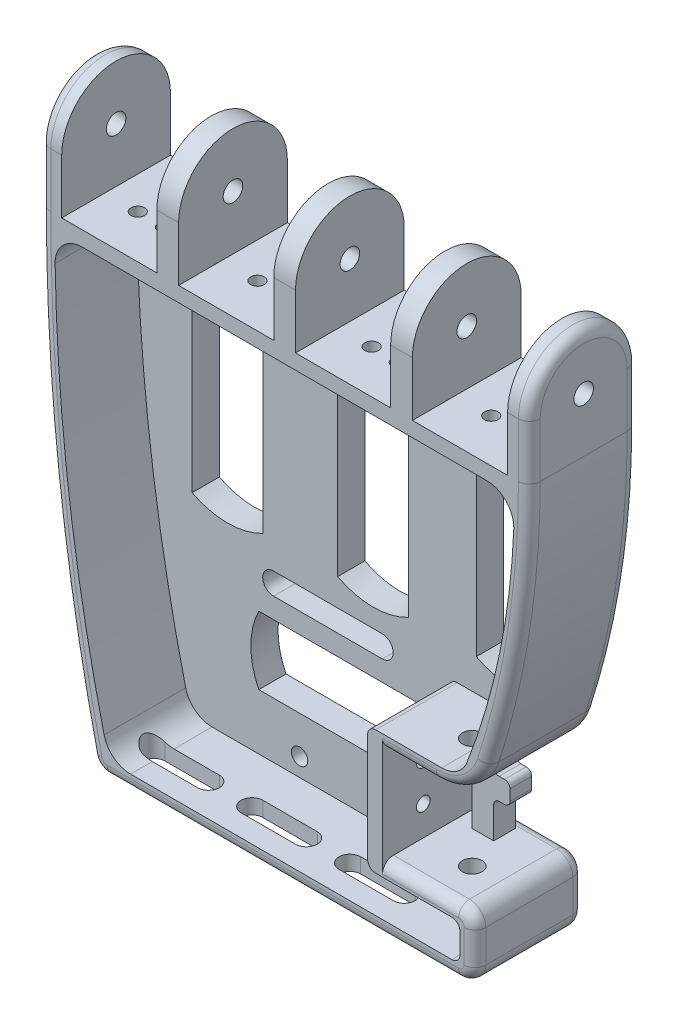
from build123d import *

# Parameters (mm, degrees)
BOSS_EXTRUDE1_DEPTH = 20
CUT_EXTRUDE1_DEPTH  = 15
SKETCH3_W           = 4
SKETCH3_H           = 20
BOSS_EXTRUDE2_DEPTH = 20
CUT_EXTRUDE2_DEPTH  = 140.731886125
SKETCH4_4_R         = 1.8
CUT_EXTRUDE3_DEPTH  = 140.731886125
SKETCH7_R           = 1.8
CUT_EXTRUDE5_DEPTH  = 25
SKETCH9_R           = 1.25
CUT_EXTRUDE6_DEPTH  = 10
SKETCH10_W          = 13
SKETCH10_H          = 35
CUT_EXTRUDE9_DEPTH  = 21.5
SKETCH11_R          = 1.25
CUT_EXTRUDE10_DEPTH = 33
SKETCH12_W          = 30
SKETCH12_H          = 12.5
CUT_EXTRUDE11_DEPTH = 31.5
SKETCH15_R          = 1.5
CUT_EXTRUDE13_DEPTH = 50
CUT_EXTRUDE14_DEPTH = 7
CUT_EXTRUDE15_DEPTH = 28.5
FILLET1_R           = 10
FILLET2_R           = 3
FILLET3_R           = 3
FILLET4_R           = 3
FILLET6_R           = 2
FILLET7_R           = 2
SKETCH18_W          = 4
SKETCH18_H          = 4
BOSS_EXTRUDE3_DEPTH = 17.6
SKETCH19_W          = 4
SKETCH19_H          = 4
BOSS_EXTRUDE4_DEPTH = 3
FILLET12_R          = 1


with BuildPart() as part:
    # Sketch1 → Boss-Extrude1 (new body)
    with BuildSketch(Plane.XY):
        with BuildLine():
            Line((0, 0), (-70, 0))
            ThreePointArc((-70, 0), (-77.491408833, 42.206893078), (-80, 85))
            Line((-80, 85), (10, 85))
            ThreePointArc((10, 85), (7.480734581, 56.852621875), (0.003021395, 29.6))
            Line((0.003021395, 29.6), (-16.996978605, 29.6))
            Line((-16.996978605, 29.6), (-16.996978605, 12))
            Line((-16.996978605, 12), (0, 12))
            Line((0, 12), (0, 0))
        make_face()
    extrude(amount=BOSS_EXTRUDE1_DEPTH)

    # Sketch2 → Cut-Extrude1 (cut)
    with BuildSketch(Plane.XY.offset(20)):
        with BuildLine():
            Line((2.149619209, 82.25), (-72.210442127, 82.25))
            ThreePointArc((-72.210442127, 82.25), (-75.773836153, 80.757452496), (-77.209816236, 77.170889205))
            ThreePointArc((-77.209816236, 77.170889205), (-74.668467732, 41.620651671), (-68.20184384, 6.571249159))
            ThreePointArc((-68.20184384, 6.571249159), (-66.433588024, 3.819748468), (-63.342775364, 2.75))
            Line((-63.342775364, 2.75), (-4.25, 2.75))
            ThreePointArc((-4.25, 2.75), (-3.189339828, 3.189339828), (-2.75, 4.25))
            Line((-2.75, 4.25), (-2.75, 8))
            ThreePointArc((-2.75, 8), (-3.189339828, 9.060660172), (-4.25, 9.5))
            Line((-4.25, 9.5), (-18.243685565, 9.5))
            Line((-18.243685565, 9.5), (-19.743685565, 9.5))
            Line((-19.743685565, 9.5), (-19.743685565, 11))
            Line((-19.743685565, 11), (-19.743685565, 30.85))
            Line((-19.743685565, 30.85), (-19.743685565, 32.35))
            Line((-19.743685565, 32.35), (-18.243685565, 32.35))
            Line((-18.243685565, 32.35), (-6.122859331, 32.35))
            ThreePointArc((-6.122859331, 32.35), (-3.295366032, 33.226253931), (-1.45891358, 35.547887342))
            ThreePointArc((-1.45891358, 35.547887342), (4.551718513, 55.944404372), (7.145590312, 77.049319303))
            ThreePointArc((7.145590312, 77.049319303), (5.755406466, 80.713855981), (2.149619209, 82.25))
        make_face()
        with BuildLine():
            ThreePointArc((-19.743685565, 30.85), (-19.304345736, 31.910660172), (-18.243685565, 32.35))
            Line((-18.243685565, 32.35), (-19.743685565, 32.35))
            Line((-19.743685565, 32.35), (-19.743685565, 30.85))
        make_face()
        with BuildLine():
            ThreePointArc((-18.243685565, 9.5), (-19.304345736, 9.939339828), (-19.743685565, 11))
            Line((-19.743685565, 11), (-19.743685565, 9.5))
            Line((-19.743685565, 9.5), (-18.243685565, 9.5))
        make_face()
    extrude(amount=-CUT_EXTRUDE1_DEPTH, mode=Mode.SUBTRACT)

    # Sketch3 → Boss-Extrude2 (add)
    with BuildSketch(Plane(origin=(0, 85, 0), x_dir=(1, 0, 0), z_dir=(0, 1, 0))):
        with Locations((-78, -10)):
            Rectangle(SKETCH3_W, SKETCH3_H)
        with Locations((-56.5, -10)):
            Rectangle(SKETCH3_W, SKETCH3_H)
        with Locations((-35, -10)):
            Rectangle(SKETCH3_W, SKETCH3_H)
        with Locations((-13.5, -10)):
            Rectangle(SKETCH3_W, SKETCH3_H)
        with Locations((8, -10)):
            Rectangle(SKETCH3_W, SKETCH3_H)
    extrude(amount=BOSS_EXTRUDE2_DEPTH)

    # Sketch4 → Cut-Extrude2 (cut, through all)
    with BuildSketch(Plane.ZY.offset(80)):
        with BuildLine():
            Line((0, 105), (0, 95))
            ThreePointArc((0, 95), (2.928932188, 102.071067812), (10, 105))
            Line((10, 105), (0, 105))
        make_face()
        with BuildLine():
            Line((20, 105), (10, 105))
            ThreePointArc((10, 105), (17.071067812, 102.071067812), (20, 95))
            Line((20, 95), (20, 105))
        make_face()
    extrude(amount=-CUT_EXTRUDE2_DEPTH, mode=Mode.SUBTRACT)

    # Sketch4<4> → Cut-Extrude3 (cut, through all)
    with BuildSketch(Plane.ZY.offset(80)):
        with Locations((10, 95)):
            Circle(SKETCH4_4_R)
    extrude(amount=-CUT_EXTRUDE3_DEPTH, mode=Mode.SUBTRACT)

    # Sketch7 → Cut-Extrude5 (cut)
    with BuildSketch(Plane(origin=(0, 32.35, 0), x_dir=(1, 0, 0), z_dir=(0, 1, 0))):
        with Locations(Location((-7.996978605, -12.5, 0), (0, 0, 270))):
            Circle(SKETCH7_R)
    extrude(amount=-CUT_EXTRUDE5_DEPTH, mode=Mode.SUBTRACT)

    # Sketch9 → Cut-Extrude6 (cut)
    with BuildSketch(Plane(origin=(0, 85, 0), x_dir=(1, 0, 0), z_dir=(0, 1, 0))):
        with Locations(Location((-70, -12, 0), (0, 0, 270))):
            Circle(SKETCH9_R)
        with Locations(Location((-65, -12, 0), (0, 0, 270))):
            Circle(SKETCH9_R)
        with Locations(Location((-48, -12, 0), (0, 0, 90))):
            Circle(SKETCH9_R)
        with Locations(Location((-43, -12, 0), (0, 0, 90))):
            Circle(SKETCH9_R)
        with Locations(Location((-27, -12, 0), (0, 0, 270))):
            Circle(SKETCH9_R)
        with Locations(Location((-22, -12, 0), (0, 0, 270))):
            Circle(SKETCH9_R)
        with Locations(Location((-5, -12, 0), (0, 0, 90))):
            Circle(SKETCH9_R)
        with Locations(Location((0, -12, 0), (0, 0, 90))):
            Circle(SKETCH9_R)
    extrude(amount=-CUT_EXTRUDE6_DEPTH, mode=Mode.SUBTRACT)

    # Sketch10 → Cut-Extrude9 (cut, symmetric)
    with BuildSketch(Plane.XY.offset(6)):
        with Locations((-60.5, 55.75)):
            Rectangle(SKETCH10_W, SKETCH10_H)
        with Locations((-33.75, 55.75)):
            Rectangle(SKETCH10_W, SKETCH10_H)
        with Locations((-8.25, 55.75)):
            Rectangle(SKETCH10_W, SKETCH10_H)
        with BuildLine():
            Line((-14.75, 38.25), (-1.75, 38.25))
            ThreePointArc((-1.75, 38.25), (-8.25, 36.649596768), (-14.75, 38.25))
        make_face()
        with BuildLine():
            Line((-40.25, 38.25), (-27.25, 38.25))
            ThreePointArc((-27.25, 38.25), (-33.75, 36.649596768), (-40.25, 38.25))
        make_face()
        with BuildLine():
            Line((-67, 38.25), (-54, 38.25))
            ThreePointArc((-54, 38.25), (-60.5, 36.649596768), (-67, 38.25))
        make_face()
        with BuildLine():
            ThreePointArc((-67, 73.25), (-60.5, 74.850403232), (-54, 73.25))
            Line((-54, 73.25), (-67, 73.25))
        make_face()
        with BuildLine():
            ThreePointArc((-40.25, 73.25), (-33.75, 74.850403232), (-27.25, 73.25))
            Line((-27.25, 73.25), (-40.25, 73.25))
        make_face()
        with BuildLine():
            ThreePointArc((-14.75, 73.25), (-8.25, 74.850403232), (-1.75, 73.25))
            Line((-1.75, 73.25), (-14.75, 73.25))
        make_face()
    extrude(amount=CUT_EXTRUDE9_DEPTH, both=True, mode=Mode.SUBTRACT)

    # Sketch11 → Cut-Extrude10 (cut)
    with BuildSketch(Plane.ZY.offset(19.743685565)):
        with Locations((12.5, 24.455)):
            Circle(SKETCH11_R)
        with Locations((12.5, 17.455)):
            Circle(SKETCH11_R)
    extrude(amount=-CUT_EXTRUDE10_DEPTH, mode=Mode.SUBTRACT)

    # Sketch12 → Cut-Extrude11 (cut, symmetric)
    with BuildSketch(Plane.XY.offset(6)):
        with Locations((-39.743685565, 19.25)):
            Rectangle(SKETCH12_W, SKETCH12_H)
        with BuildLine():
            ThreePointArc((-24.743685565, 25.5), (-23.271155381, 19.25), (-24.743685565, 13))
            Line((-24.743685565, 13), (-24.743685565, 25.5))
        make_face()
        with BuildLine():
            Line((-54.743685565, 25.5), (-54.743685565, 13))
            ThreePointArc((-54.743685565, 13), (-56.216215748, 19.25), (-54.743685565, 25.5))
        make_face()
    extrude(amount=CUT_EXTRUDE11_DEPTH, both=True, mode=Mode.SUBTRACT)

    # Sketch15 → Cut-Extrude13 (cut, symmetric)
    with BuildSketch(Plane.XY.offset(6)):
        with Locations(Location((-47.25, 6.125, 0), (0, 0, 180))):
            Circle(SKETCH15_R)
        with Locations(Location((-19.743685565, 6.125, 0), (0, 0, 180))):
            Circle(SKETCH15_R)
        with Locations(Location((1.75, 76.125, 0), (0, 0, 180))):
            Circle(SKETCH15_R)
        with Locations(Location((-47.25, 76.125, 0), (0, 0, 180))):
            Circle(SKETCH15_R)
    extrude(amount=CUT_EXTRUDE13_DEPTH, both=True, mode=Mode.SUBTRACT)

    # Sketch16 → Cut-Extrude14 (cut)
    with BuildSketch(Plane.XZ):
        with BuildLine():
            Line((-37, 12), (-47, 12))
            ThreePointArc((-47, 12), (-49, 14), (-47, 16))
            Line((-47, 16), (-37, 16))
            ThreePointArc((-37, 16), (-35, 14), (-37, 12))
        make_face()
        with BuildLine():
            Line((-29, 16), (-19, 16))
            ThreePointArc((-19, 16), (-17, 14), (-19, 12))
            Line((-19, 12), (-29, 12))
            ThreePointArc((-29, 12), (-31, 14), (-29, 16))
        make_face()
        with BuildLine():
            Line((-55, 12), (-65, 12))
            ThreePointArc((-65, 12), (-67, 14), (-65, 16))
            Line((-65, 16), (-55, 16))
            ThreePointArc((-55, 16), (-53, 14), (-55, 12))
        make_face()
    extrude(amount=-CUT_EXTRUDE14_DEPTH, mode=Mode.SUBTRACT)

    # Sketch17 → Cut-Extrude15 (cut, symmetric)
    with BuildSketch(Plane.XY.offset(6)):
        with BuildLine():
            Line((-52.030411459, 33.25), (-32.030411459, 33.25))
            ThreePointArc((-32.030411459, 33.25), (-30.030411459, 31.25), (-32.030411459, 29.25))
            Line((-32.030411459, 29.25), (-52.030411459, 29.25))
            ThreePointArc((-52.030411459, 29.25), (-54.030411459, 31.25), (-52.030411459, 33.25))
        make_face()
    extrude(amount=CUT_EXTRUDE15_DEPTH, both=True, mode=Mode.SUBTRACT)

    # Fillet1
    # the kernel refuses this fillet: 10 mm, written as the material it takes off along each edge
    with BuildSketch(Plane(origin=(0.003021395, 29.6, -18.37153932), x_dir=(-1, 0, 0), z_dir=(0, 0, 1))) as fillet1_piece_1:
        with BuildLine():
            CenterArc((7.113026, -10), FILLET1_R, 90, 72.198634336)
            ThreePointArc((-2.408195061, -6.942820008), (-1.244338894, -3.457451835), (0, 0))
            Line((0, 0), (7.113026, 0))
        make_face()
    extrude(amount=56.743078639, mode=Mode.SUBTRACT)

    # Fillet2
    fillet2_edges = [part.edges().sort_by_distance(p)[0] for p in [
        (0, 12, 10),
    ]]
    fillet(fillet2_edges, radius=FILLET2_R)

    # Fillet3
    fillet3_edges = [part.edges().sort_by_distance(p)[0] for p in [
        (0, 0, 10),
    ]]
    fillet(fillet3_edges, radius=FILLET3_R)

    # Fillet4
    fillet4_edges = [part.edges().sort_by_distance(p)[0] for p in [
        (-70, 0, 10),
    ]]
    fillet(fillet4_edges, radius=FILLET4_R)

    # Fillet6
    fillet6_edges = [part.edges().sort_by_distance(p)[0] for p in [
        (10, 90, 20),
        (-12.053491605, 29.6, 20),
        (10, 105, 10),
        (10, 90, 0),
        (8.091311924, 60.476093661, 0),
        (8.091311924, 60.476093661, 20),
        (-1.218137325, 31.520030943, 0),
        (-1.218137325, 31.520030943, 20),
        (-12.053491605, 29.6, 0),
    ]]
    fillet(fillet6_edges, radius=FILLET6_R)

    # Fillet7
    fillet7_edges = [part.edges().sort_by_distance(p)[0] for p in [
        (-80, 90, 20),
        (-80, 105, 10),
        (-80, 90, 0),
        (-77.62887866, 43.392018011, 20),
        (-9.998489302, 12, 0),
        (-9.998489302, 12, 20),
        (-0.878679656, 11.121320344, 0),
        (-0.878679656, 11.121320344, 20),
        (0, 6, 0),
        (0, 6, 20),
        (-0.878679656, 0.878679656, 0),
        (-0.878679656, 0.878679656, 20),
        (-35.31182665, 0, 0),
        (-35.31182665, 0, 20),
        (-69.490246636, 0.651419723, 0),
        (-69.490246636, 0.651419723, 20),
        (-77.62887866, 43.392018011, 0),
    ]]
    fillet(fillet7_edges, radius=FILLET7_R)

    # Sketch18 → Boss-Extrude3 (add)
    with BuildSketch(Plane.XZ.offset(-29.6)):
        with Locations((-12.053491605, 4.5)):
            Rectangle(SKETCH18_W, SKETCH18_H)
    extrude(amount=BOSS_EXTRUDE3_DEPTH)

    # Sketch19 → Boss-Extrude4 (add)
    with BuildSketch(Plane(origin=(-10.053491605, 0, 0), x_dir=(0, 0, -1), z_dir=(1, 0, 0))):
        with Locations((-4.5, 20.8)):
            Rectangle(SKETCH19_W, SKETCH19_H)
    extrude(amount=BOSS_EXTRUDE4_DEPTH)

    # Fillet12
    fillet12_edges = [part.edges().sort_by_distance(p)[0] for p in [
        (-10.053491605, 18.8, 4.5),
        (-10.053491605, 22.8, 4.5),
        (-7.053491605, 18.8, 4.5),
        (-7.053491605, 22.8, 4.5),
    ]]
    fillet(fillet12_edges, radius=FILLET12_R)


solid = part.part
